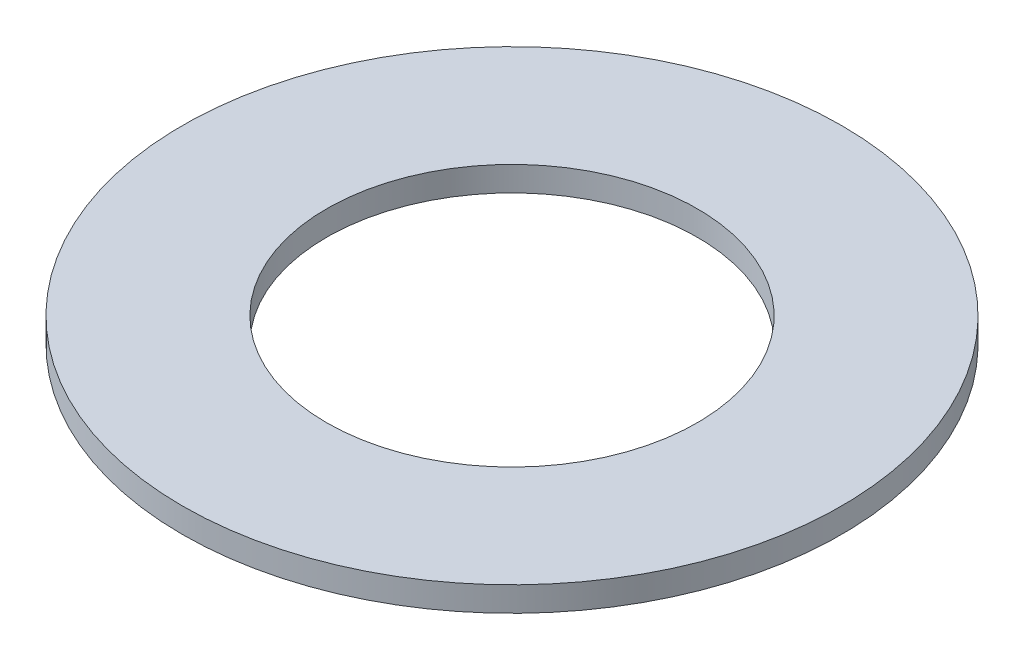
from build123d import *

# Parameters (mm, degrees)
SKETCH1_R           = 80
BOSS_EXTRUDE1_DEPTH = 6
SKETCH2_R           = 45
CUT_EXTRUDE1_DEPTH  = 114.296072306


with BuildPart() as part:
    # Sketch1 → Boss-Extrude1 (new body)
    with BuildSketch(Plane(origin=(0, 0, 0), x_dir=(1, 0, 0), z_dir=(0, 1, 0))):
        Circle(SKETCH1_R)
    extrude(amount=BOSS_EXTRUDE1_DEPTH)

    # Sketch2 → Cut-Extrude1 (cut, through all)
    with BuildSketch(Plane(origin=(0, 0, 0), x_dir=(1, 0, 0), z_dir=(0, 1, 0))):
        Circle(SKETCH2_R)
    extrude(amount=CUT_EXTRUDE1_DEPTH, mode=Mode.SUBTRACT)


solid = part.part
